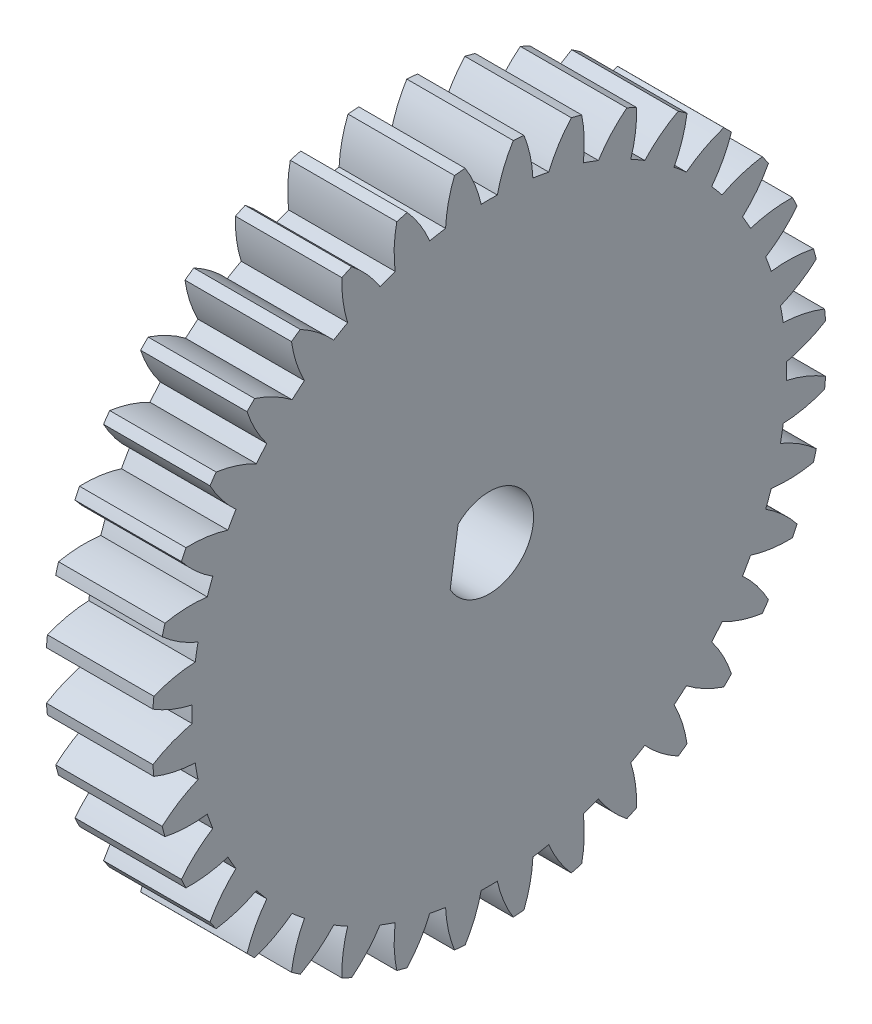
from build123d import *

# Parameters (mm, degrees)
BASPROSKE_W     = 6
BASPROSKE_H     = 19
TOOTHCUT_DEPTH  = 28.531799796
TEETHCUTS_COUNT = 36
BORE_DEPTH      = 50.0000508


with BuildPart() as part:
    # BasProSke → Base-Revolve (revolve)
    with BuildSketch(Plane(origin=(0, 0, 0), x_dir=(1, 0, 0), z_dir=(0, 1, 0))):
        with Locations((3, 9.5)):
            Rectangle(BASPROSKE_W, BASPROSKE_H)
    revolve(axis=Axis((-10, 0, 0), (1, 0, 0)))

    # TooCutSke → ToothCut (cut, through all)
    with BuildSketch(Plane(origin=(0, 0, 0), x_dir=(0, 0, -1), z_dir=(1, 0, 0))):
        with BuildLine():
            ThreePointArc((0.454664826, 16.742827745), (0, 16.749), (-0.454664826, 16.742827745))
            ThreePointArc((-0.454664826, 16.742827745), (-0.817558311, 17.898033097), (-1.368909141, 18.976088452))
            ThreePointArc((-1.368909141, 18.976088452), (0, 19.0254), (1.368909141, 18.976088452))
            ThreePointArc((1.368909141, 18.976088452), (0.817558311, 17.898033097), (0.454664826, 16.742827745))
        make_face()
    toothcut = extrude(amount=TOOTHCUT_DEPTH, mode=Mode.SUBTRACT)

    # TeethCuts: ToothCut ×36 about axis
    teethcuts_axis = Axis((-10, 0, 0), (1, 0, 0))
    for i in range(1, TEETHCUTS_COUNT):
        add(toothcut.rotate(teethcuts_axis, i * 360 / TEETHCUTS_COUNT), mode=Mode.SUBTRACT)

    # BorSke → Bore (cut, symmetric)
    with BuildSketch(Plane(origin=(0, 0, 0), x_dir=(0, 0, -1), z_dir=(1, 0, 0))):
        with BuildLine():
            Line((-2.200434536, -1.186628775), (-1.755285295, 1.780161098))
            ThreePointArc((-1.755285295, 1.780161098), (2.472324894, -0.370957702), (-2.200434536, -1.186628775))
        make_face()
    extrude(amount=BORE_DEPTH, both=True, mode=Mode.SUBTRACT)


solid = part.part
